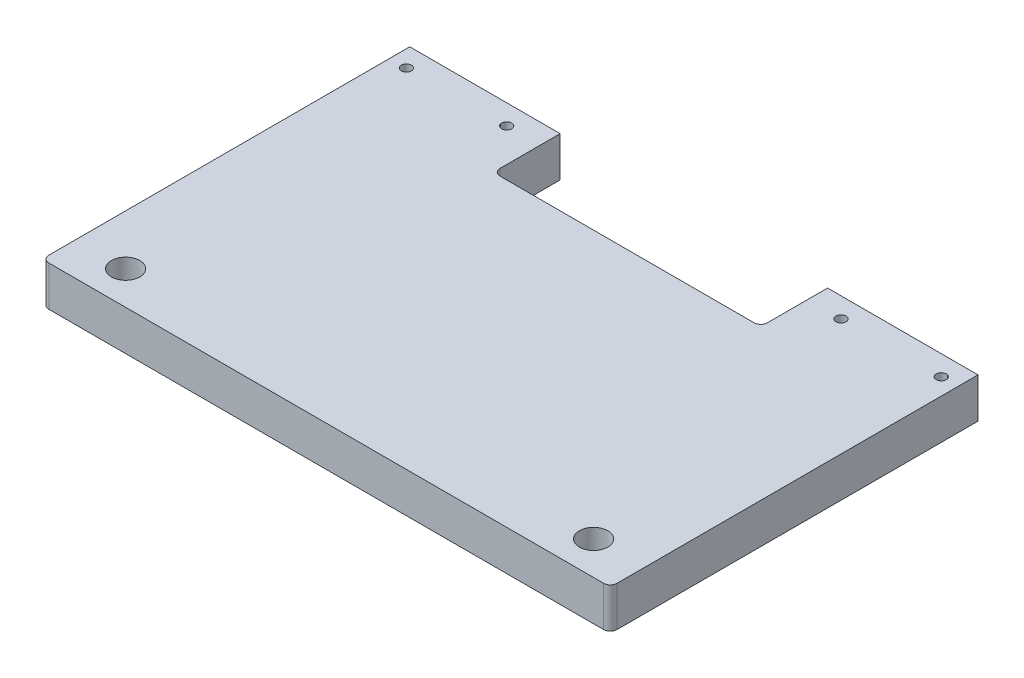
from build123d import *

# Parameters (mm, degrees)
SKETCH1_R           = 4.25
SKETCH1_R_2         = 1.5
BOSS_EXTRUDE1_DEPTH = 12
FILLET1_R           = 2


with BuildPart() as part:
    # Sketch1 → Boss-Extrude1 (new body)
    with BuildSketch(Plane(origin=(0, 0, 0), x_dir=(1, 0, 0), z_dir=(0, 1, 0))):
        Polygon((0, 0), (170, 0), (170, 110), (125, 110), (125, 90), (45, 90), (45, 110), (0, 110), align=None)
        with Locations((155, 10)):
            Circle(SKETCH1_R, mode=Mode.SUBTRACT)
        with Locations((15, 10)):
            Circle(SKETCH1_R, mode=Mode.SUBTRACT)
        with Locations((5, 104)):
            Circle(SKETCH1_R_2, mode=Mode.SUBTRACT)
        with Locations((35, 104)):
            Circle(SKETCH1_R_2, mode=Mode.SUBTRACT)
        with Locations((165, 104)):
            Circle(SKETCH1_R_2, mode=Mode.SUBTRACT)
        with Locations((135, 104)):
            Circle(SKETCH1_R_2, mode=Mode.SUBTRACT)
    extrude(amount=BOSS_EXTRUDE1_DEPTH)

    # Fillet1
    fillet1_edges = [part.edges().sort_by_distance(p)[0] for p in [
        (170, 6, 0),
        (0, 6, 0),
        (125, 6, -90),
        (45, 6, -90),
    ]]
    fillet(fillet1_edges, radius=FILLET1_R)


solid = part.part
